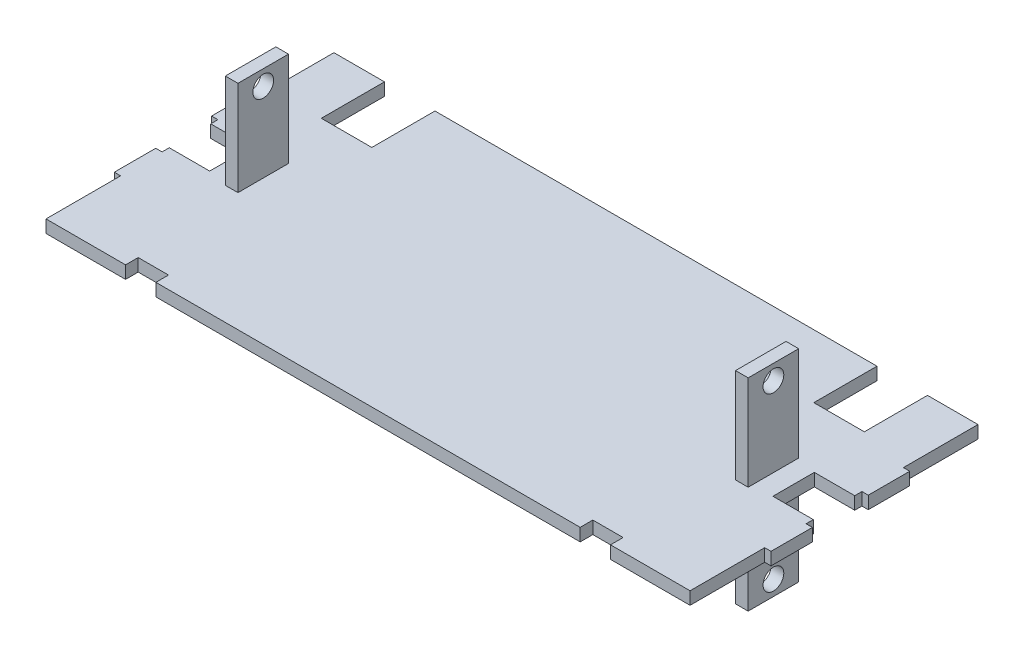
from build123d import *

# Parameters (mm, degrees)
BOSS_EXTRUDE1_DEPTH     = 3.175
SKETCH2_W               = 6.35
SKETCH2_H               = 25.4
BOSS_EXTRUDE2_DEPTH     = 50.8
CUT_EXTRUDE1_DEPTH      = 310.45094785
CUT_EXTRUDE1_DEPTH_BACK = 310.45094785
SKETCH3_R               = 5.207


with BuildPart() as part:
    # Sketch1 → Boss-Extrude1 (new, symmetric)
    with BuildSketch(Plane(origin=(0, 0, 0), x_dir=(1, 0, 0), z_dir=(0, 1, 0))):
        Polygon((161.925, -72.39), (121.92, -72.39), (121.92, -66.04), (106.68, -66.04), (106.68, -72.39), (-106.68, -72.39), (-106.68, -66.04), (-121.92, -66.04), (-121.92, -72.39), (-161.925, -72.39), (-161.925, -34.874677354), (-165.1, -34.874677354), (-165.1, -14.046677354), (-161.925, -14.046677354), (-161.925, -10.414), (-141.605, -10.414), (-141.605, 10.414), (-161.925, 10.414), (-161.925, 14.046677354), (-165.1, 14.046677354), (-165.1, 34.874677354), (-161.925, 34.874677354), (-161.925, 72.39), (-136.525, 72.39), (-136.525, 40.64), (-111.125, 40.64), (-111.125, 72.39), (111.125, 72.39), (111.125, 40.64), (136.525, 40.64), (136.525, 72.39), (161.925, 72.39), (161.925, 34.874677354), (165.1, 34.874677354), (165.1, 14.046677354), (161.925, 14.046677354), (161.925, 10.414), (141.605, 10.414), (141.605, -10.414), (161.925, -10.414), (161.925, -14.046677354), (165.1, -14.046677354), (165.1, -34.874677354), (161.925, -34.874677354), align=None)
    extrude(amount=BOSS_EXTRUDE1_DEPTH, both=True)

    # Sketch2 → Boss-Extrude2 (add, symmetric)
    with BuildSketch(Plane(origin=(0, 0, 0), x_dir=(1, 0, 0), z_dir=(0, 1, 0))):
        with Locations((128.27, 0)):
            Rectangle(SKETCH2_W, SKETCH2_H)
        with Locations((-128.27, 0)):
            Rectangle(SKETCH2_W, SKETCH2_H)
    extrude(amount=BOSS_EXTRUDE2_DEPTH, both=True)

    # Sketch3 → Cut-Extrude1 (cut, two sides: drawn at the far end of the back side and taken through both)
    with BuildSketch(Plane.ZY.offset(131.445).offset(-CUT_EXTRUDE1_DEPTH_BACK)):
        with Locations((0, 43.18)):
            Circle(SKETCH3_R)
        with Locations((0, -43.18)):
            Circle(SKETCH3_R)
    extrude(amount=CUT_EXTRUDE1_DEPTH + CUT_EXTRUDE1_DEPTH_BACK, mode=Mode.SUBTRACT)


solid = part.part
